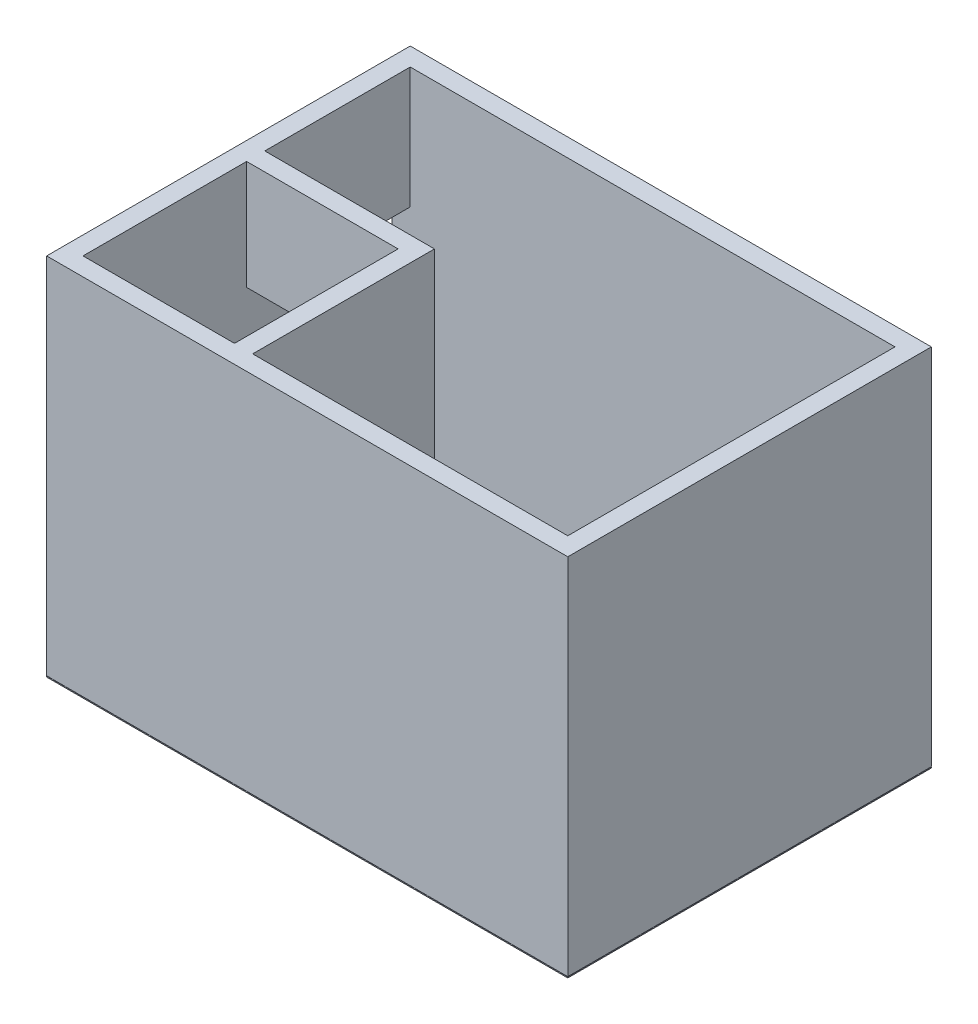
from build123d import *

# Parameters (mm, degrees)
EXTRUDE_THIN1_OUTLINE_W   = 4300
EXTRUDE_THIN1_OUTLINE_H   = 3000
EXTRUDE_THIN1_OUTLINE_W_2 = 1250
EXTRUDE_THIN1_OUTLINE_H_2 = 1350
EXTRUDE_THIN1_DEPTH       = 3000
SKETCH2_W                 = 4300
SKETCH2_H                 = 3000
BOSS_EXTRUDE1_DEPTH       = 10
SKETCH4_W                 = 750
SKETCH4_H                 = 2000
CUT_EXTRUDE2_DEPTH        = 150
SKETCH5_W                 = 1000
SKETCH5_H                 = 1000
SKETCH5_W_2               = 600
SKETCH5_H_2               = 600
CUT_EXTRUDE3_DEPTH        = 150
SKETCH3_W                 = 750
SKETCH3_H                 = 2000
CUT_EXTRUDE6_DEPTH        = 150
BOSS_EXTRUDE2_DEPTH       = 100
SKETCH9_OUTSIDE_W         = 5511.134
SKETCH9_OUTSIDE_H         = 4211.134
SKETCH9_OUTSIDE_W_2       = 295
SKETCH9_OUTSIDE_H_2       = 295
SKETCH9_OUTSIDE_W_3       = 265
SKETCH9_OUTSIDE_H_3       = 120
SKETCH9_OUTSIDE_W_4       = 170
SKETCH9_OUTSIDE_W_5       = 50
SKETCH9_OUTSIDE_H_4       = 250
SKETCH9_OUTSIDE_W_6       = 49.914712664
SKETCH9_OUTSIDE_W_7       = 150
CUT_EXTRUDE7_DEPTH        = 2
SKETCH11_W                = 750
SKETCH11_H                = 100
CUT_EXTRUDE9_DEPTH        = 182
SKETCH14_R                = 62.5
CUT_EXTRUDE11_DEPTH       = 10


# Read off the part's stored shape, not the designer's step: Extrude-Thin1
with BuildPart() as part:
    # Extrude-Thin1 outline → Extrude-Thin1 (new body)
    with BuildSketch(Plane(origin=(0, 0, 0), x_dir=(1, 0, 0), z_dir=(0, 1, 0))):
        with Locations((-2000, -1334.057701573)):
            Rectangle(EXTRUDE_THIN1_OUTLINE_W, EXTRUDE_THIN1_OUTLINE_H)
        with Locations((-3375, -2009.057701573)):
            Rectangle(EXTRUDE_THIN1_OUTLINE_W_2, EXTRUDE_THIN1_OUTLINE_H_2, mode=Mode.SUBTRACT)
        Polygon((-2600, -2684.057701573), (-2600, -1184.057701573), (-4000, -1184.057701573), (-4000, 15.942298427), (0, 15.942298427), (0, -2684.057701573), align=None, mode=Mode.SUBTRACT)
    extrude(amount=EXTRUDE_THIN1_DEPTH)

    # Sketch2 → Boss-Extrude1 (add)
    with BuildSketch(Plane.XZ):
        with Locations((-2000, 1334.057701573)):
            Rectangle(SKETCH2_W, SKETCH2_H)
    extrude(amount=BOSS_EXTRUDE1_DEPTH)

    # Sketch4 → Cut-Extrude2 (cut)
    with BuildSketch(Plane(origin=(0, 0, 1184.057701573), x_dir=(-1, 0, 0), z_dir=(0, 0, -1))):
        with Locations((3625, 1100)):
            Rectangle(SKETCH4_W, SKETCH4_H)
    extrude(amount=-CUT_EXTRUDE2_DEPTH, mode=Mode.SUBTRACT)

    # Sketch5 → Cut-Extrude3 (cut)
    with BuildSketch(Plane(origin=(-4000, 0, 0), x_dir=(0, 0, -1), z_dir=(1, 0, 0))):
        with Locations((-484.057701573, 1500)):
            Rectangle(SKETCH5_W, SKETCH5_H)
        with Locations((-2009.057701573, 1700)):
            Rectangle(SKETCH5_W_2, SKETCH5_H_2)
    extrude(amount=-CUT_EXTRUDE3_DEPTH, mode=Mode.SUBTRACT)

    # Sketch3 → Cut-Extrude6 (cut, symmetric)
    with BuildSketch(Plane.XY.offset(-15.942298427)):
        with Locations((-425, 1000)):
            Rectangle(SKETCH3_W, SKETCH3_H)
    extrude(amount=CUT_EXTRUDE6_DEPTH, both=True, mode=Mode.SUBTRACT)

    # Sketch6 → Boss-Extrude2 (add)
    with BuildSketch(Plane(origin=(0, 0, 0), x_dir=(1, 0, 0), z_dir=(0, 1, 0))):
        Polygon((-800, 15.942298427), (-4000, 15.942298427), (-4000, -1184.057701573), (-2600, -1184.057701573), (-2600, -2684.057701573), (0, -2684.057701573), (0, 15.942298427), (-50, 15.942298427), (-50, 165.942298427), (-800, 165.942298427), align=None)
        Polygon((-780, 145.942298427), (-70, 145.942298427), (-70, -4.057701573), (-20, -4.057701573), (-20, -2664.057701573), (-2580, -2664.057701573), (-2580, -1164.057701573), (-3980, -1164.057701573), (-3980, -4.057701573), (-780, -4.057701573), align=None, mode=Mode.SUBTRACT)
    extrude(amount=BOSS_EXTRUDE2_DEPTH)

    # Sketch9 outside → Cut-Extrude7 (cut)
    with BuildSketch(Plane(origin=(0, 0, 0), x_dir=(1, 0, 0), z_dir=(0, 1, 0))):
        with Locations((-2000, -1334.058)):
            Rectangle(SKETCH9_OUTSIDE_W, SKETCH9_OUTSIDE_H)
        with Locations((-172.5, -2511.557701573)):
            Rectangle(SKETCH9_OUTSIDE_W_2, SKETCH9_OUTSIDE_H_2, mode=Mode.SUBTRACT)
        with Locations((-172.5, -2211.557701573)):
            Rectangle(SKETCH9_OUTSIDE_W_2, SKETCH9_OUTSIDE_H_2, mode=Mode.SUBTRACT)
        with Locations((-172.5, -1911.557701573)):
            Rectangle(SKETCH9_OUTSIDE_W_2, SKETCH9_OUTSIDE_H_2, mode=Mode.SUBTRACT)
        with Locations((-172.5, -1611.557701573)):
            Rectangle(SKETCH9_OUTSIDE_W_2, SKETCH9_OUTSIDE_H_2, mode=Mode.SUBTRACT)
        with Locations((-172.5, -1311.557701573)):
            Rectangle(SKETCH9_OUTSIDE_W_2, SKETCH9_OUTSIDE_H_2, mode=Mode.SUBTRACT)
        with Locations((-172.5, -1011.557701573)):
            Rectangle(SKETCH9_OUTSIDE_W_2, SKETCH9_OUTSIDE_H_2, mode=Mode.SUBTRACT)
        with Locations((-172.5, -711.557701573)):
            Rectangle(SKETCH9_OUTSIDE_W_2, SKETCH9_OUTSIDE_H_2, mode=Mode.SUBTRACT)
        with Locations((-172.5, -411.557701573)):
            Rectangle(SKETCH9_OUTSIDE_W_2, SKETCH9_OUTSIDE_H_2, mode=Mode.SUBTRACT)
        Polygon((-25, -259.057701573), (-25, -9.057701573), (-55, -9.057701573), (-55, 35.942298427), (-320, 35.942298427), (-320, -259.057701573), align=None, mode=Mode.SUBTRACT)
        with Locations((-187.5, 100.942298427)):
            Rectangle(SKETCH9_OUTSIDE_W_3, SKETCH9_OUTSIDE_H_3, mode=Mode.SUBTRACT)
        with Locations((-472.5, -2511.557701573)):
            Rectangle(SKETCH9_OUTSIDE_W_2, SKETCH9_OUTSIDE_H_2, mode=Mode.SUBTRACT)
        with Locations((-472.5, -2211.557701573)):
            Rectangle(SKETCH9_OUTSIDE_W_2, SKETCH9_OUTSIDE_H_2, mode=Mode.SUBTRACT)
        with Locations((-472.5, -1911.557701573)):
            Rectangle(SKETCH9_OUTSIDE_W_2, SKETCH9_OUTSIDE_H_2, mode=Mode.SUBTRACT)
        with Locations((-472.5, -1611.557701573)):
            Rectangle(SKETCH9_OUTSIDE_W_2, SKETCH9_OUTSIDE_H_2, mode=Mode.SUBTRACT)
        with Locations((-472.5, -1311.557701573)):
            Rectangle(SKETCH9_OUTSIDE_W_2, SKETCH9_OUTSIDE_H_2, mode=Mode.SUBTRACT)
        with Locations((-472.5, -1011.557701573)):
            Rectangle(SKETCH9_OUTSIDE_W_2, SKETCH9_OUTSIDE_H_2, mode=Mode.SUBTRACT)
        with Locations((-472.5, -711.557701573)):
            Rectangle(SKETCH9_OUTSIDE_W_2, SKETCH9_OUTSIDE_H_2, mode=Mode.SUBTRACT)
        with Locations((-472.5, -411.557701573)):
            Rectangle(SKETCH9_OUTSIDE_W_2, SKETCH9_OUTSIDE_H_2, mode=Mode.SUBTRACT)
        with Locations((-772.5, -2511.557701573)):
            Rectangle(SKETCH9_OUTSIDE_W_2, SKETCH9_OUTSIDE_H_2, mode=Mode.SUBTRACT)
        with Locations((-772.5, -2211.557701573)):
            Rectangle(SKETCH9_OUTSIDE_W_2, SKETCH9_OUTSIDE_H_2, mode=Mode.SUBTRACT)
        with Locations((-772.5, -1911.557701573)):
            Rectangle(SKETCH9_OUTSIDE_W_2, SKETCH9_OUTSIDE_H_2, mode=Mode.SUBTRACT)
        with Locations((-772.5, -1611.557701573)):
            Rectangle(SKETCH9_OUTSIDE_W_2, SKETCH9_OUTSIDE_H_2, mode=Mode.SUBTRACT)
        with Locations((-772.5, -1311.557701573)):
            Rectangle(SKETCH9_OUTSIDE_W_2, SKETCH9_OUTSIDE_H_2, mode=Mode.SUBTRACT)
        with Locations((-772.5, -1011.557701573)):
            Rectangle(SKETCH9_OUTSIDE_W_2, SKETCH9_OUTSIDE_H_2, mode=Mode.SUBTRACT)
        with Locations((-772.5, -711.557701573)):
            Rectangle(SKETCH9_OUTSIDE_W_2, SKETCH9_OUTSIDE_H_2, mode=Mode.SUBTRACT)
        with Locations((-772.5, -411.557701573)):
            Rectangle(SKETCH9_OUTSIDE_W_2, SKETCH9_OUTSIDE_H_2, mode=Mode.SUBTRACT)
        with Locations((-1072.5, -2511.557701573)):
            Rectangle(SKETCH9_OUTSIDE_W_2, SKETCH9_OUTSIDE_H_2, mode=Mode.SUBTRACT)
        with Locations((-1072.5, -2211.557701573)):
            Rectangle(SKETCH9_OUTSIDE_W_2, SKETCH9_OUTSIDE_H_2, mode=Mode.SUBTRACT)
        with Locations((-1072.5, -1911.557701573)):
            Rectangle(SKETCH9_OUTSIDE_W_2, SKETCH9_OUTSIDE_H_2, mode=Mode.SUBTRACT)
        with Locations((-1072.5, -1611.557701573)):
            Rectangle(SKETCH9_OUTSIDE_W_2, SKETCH9_OUTSIDE_H_2, mode=Mode.SUBTRACT)
        with Locations((-1072.5, -1311.557701573)):
            Rectangle(SKETCH9_OUTSIDE_W_2, SKETCH9_OUTSIDE_H_2, mode=Mode.SUBTRACT)
        with Locations((-1072.5, -1011.557701573)):
            Rectangle(SKETCH9_OUTSIDE_W_2, SKETCH9_OUTSIDE_H_2, mode=Mode.SUBTRACT)
        with Locations((-1072.5, -711.557701573)):
            Rectangle(SKETCH9_OUTSIDE_W_2, SKETCH9_OUTSIDE_H_2, mode=Mode.SUBTRACT)
        with Locations((-1072.5, -411.557701573)):
            Rectangle(SKETCH9_OUTSIDE_W_2, SKETCH9_OUTSIDE_H_2, mode=Mode.SUBTRACT)
        with Locations((-1372.5, -2511.557701573)):
            Rectangle(SKETCH9_OUTSIDE_W_2, SKETCH9_OUTSIDE_H_2, mode=Mode.SUBTRACT)
        with Locations((-1372.5, -2211.557701573)):
            Rectangle(SKETCH9_OUTSIDE_W_2, SKETCH9_OUTSIDE_H_2, mode=Mode.SUBTRACT)
        with Locations((-1372.5, -1911.557701573)):
            Rectangle(SKETCH9_OUTSIDE_W_2, SKETCH9_OUTSIDE_H_2, mode=Mode.SUBTRACT)
        with Locations((-1372.5, -1611.557701573)):
            Rectangle(SKETCH9_OUTSIDE_W_2, SKETCH9_OUTSIDE_H_2, mode=Mode.SUBTRACT)
        with Locations((-1372.5, -1311.557701573)):
            Rectangle(SKETCH9_OUTSIDE_W_2, SKETCH9_OUTSIDE_H_2, mode=Mode.SUBTRACT)
        with Locations((-1372.5, -1011.557701573)):
            Rectangle(SKETCH9_OUTSIDE_W_2, SKETCH9_OUTSIDE_H_2, mode=Mode.SUBTRACT)
        with Locations((-1372.5, -711.557701573)):
            Rectangle(SKETCH9_OUTSIDE_W_2, SKETCH9_OUTSIDE_H_2, mode=Mode.SUBTRACT)
        with Locations((-1372.5, -411.557701573)):
            Rectangle(SKETCH9_OUTSIDE_W_2, SKETCH9_OUTSIDE_H_2, mode=Mode.SUBTRACT)
        with Locations((-1672.5, -2511.557701573)):
            Rectangle(SKETCH9_OUTSIDE_W_2, SKETCH9_OUTSIDE_H_2, mode=Mode.SUBTRACT)
        with Locations((-1672.5, -2211.557701573)):
            Rectangle(SKETCH9_OUTSIDE_W_2, SKETCH9_OUTSIDE_H_2, mode=Mode.SUBTRACT)
        with Locations((-1672.5, -1911.557701573)):
            Rectangle(SKETCH9_OUTSIDE_W_2, SKETCH9_OUTSIDE_H_2, mode=Mode.SUBTRACT)
        with Locations((-1672.5, -1611.557701573)):
            Rectangle(SKETCH9_OUTSIDE_W_2, SKETCH9_OUTSIDE_H_2, mode=Mode.SUBTRACT)
        with Locations((-1672.5, -1311.557701573)):
            Rectangle(SKETCH9_OUTSIDE_W_2, SKETCH9_OUTSIDE_H_2, mode=Mode.SUBTRACT)
        with Locations((-1672.5, -1011.557701573)):
            Rectangle(SKETCH9_OUTSIDE_W_2, SKETCH9_OUTSIDE_H_2, mode=Mode.SUBTRACT)
        with Locations((-1672.5, -711.557701573)):
            Rectangle(SKETCH9_OUTSIDE_W_2, SKETCH9_OUTSIDE_H_2, mode=Mode.SUBTRACT)
        with Locations((-1672.5, -411.557701573)):
            Rectangle(SKETCH9_OUTSIDE_W_2, SKETCH9_OUTSIDE_H_2, mode=Mode.SUBTRACT)
        with Locations((-1972.5, -2511.557701573)):
            Rectangle(SKETCH9_OUTSIDE_W_2, SKETCH9_OUTSIDE_H_2, mode=Mode.SUBTRACT)
        with Locations((-1972.5, -2211.557701573)):
            Rectangle(SKETCH9_OUTSIDE_W_2, SKETCH9_OUTSIDE_H_2, mode=Mode.SUBTRACT)
        with Locations((-1972.5, -1911.557701573)):
            Rectangle(SKETCH9_OUTSIDE_W_2, SKETCH9_OUTSIDE_H_2, mode=Mode.SUBTRACT)
        with Locations((-1972.5, -1611.557701573)):
            Rectangle(SKETCH9_OUTSIDE_W_2, SKETCH9_OUTSIDE_H_2, mode=Mode.SUBTRACT)
        with Locations((-1972.5, -1311.557701573)):
            Rectangle(SKETCH9_OUTSIDE_W_2, SKETCH9_OUTSIDE_H_2, mode=Mode.SUBTRACT)
        with Locations((-1972.5, -1011.557701573)):
            Rectangle(SKETCH9_OUTSIDE_W_2, SKETCH9_OUTSIDE_H_2, mode=Mode.SUBTRACT)
        with Locations((-1972.5, -711.557701573)):
            Rectangle(SKETCH9_OUTSIDE_W_2, SKETCH9_OUTSIDE_H_2, mode=Mode.SUBTRACT)
        with Locations((-1972.5, -411.557701573)):
            Rectangle(SKETCH9_OUTSIDE_W_2, SKETCH9_OUTSIDE_H_2, mode=Mode.SUBTRACT)
        with Locations((-2272.5, -2511.557701573)):
            Rectangle(SKETCH9_OUTSIDE_W_2, SKETCH9_OUTSIDE_H_2, mode=Mode.SUBTRACT)
        with Locations((-2272.5, -2211.557701573)):
            Rectangle(SKETCH9_OUTSIDE_W_2, SKETCH9_OUTSIDE_H_2, mode=Mode.SUBTRACT)
        with Locations((-2272.5, -1911.557701573)):
            Rectangle(SKETCH9_OUTSIDE_W_2, SKETCH9_OUTSIDE_H_2, mode=Mode.SUBTRACT)
        with Locations((-2272.5, -1611.557701573)):
            Rectangle(SKETCH9_OUTSIDE_W_2, SKETCH9_OUTSIDE_H_2, mode=Mode.SUBTRACT)
        with Locations((-2272.5, -1311.557701573)):
            Rectangle(SKETCH9_OUTSIDE_W_2, SKETCH9_OUTSIDE_H_2, mode=Mode.SUBTRACT)
        with Locations((-2272.5, -1011.557701573)):
            Rectangle(SKETCH9_OUTSIDE_W_2, SKETCH9_OUTSIDE_H_2, mode=Mode.SUBTRACT)
        with Locations((-2272.5, -711.557701573)):
            Rectangle(SKETCH9_OUTSIDE_W_2, SKETCH9_OUTSIDE_H_2, mode=Mode.SUBTRACT)
        with Locations((-2272.5, -411.557701573)):
            Rectangle(SKETCH9_OUTSIDE_W_2, SKETCH9_OUTSIDE_H_2, mode=Mode.SUBTRACT)
        with Locations((-472.5, -111.557701573)):
            Rectangle(SKETCH9_OUTSIDE_W_2, SKETCH9_OUTSIDE_H_2, mode=Mode.SUBTRACT)
        Polygon((-625, -259.057701573), (-625, 35.942298427), (-795, 35.942298427), (-795, -9.057701573), (-920, -9.057701573), (-920, -259.057701573), align=None, mode=Mode.SUBTRACT)
        with Locations((-472.5, 100.942298427)):
            Rectangle(SKETCH9_OUTSIDE_W_2, SKETCH9_OUTSIDE_H_3, mode=Mode.SUBTRACT)
        with Locations((-710, 100.942298427)):
            Rectangle(SKETCH9_OUTSIDE_W_4, SKETCH9_OUTSIDE_H_3, mode=Mode.SUBTRACT)
        with Locations((-3950, -411.557701573)):
            Rectangle(SKETCH9_OUTSIDE_W_5, SKETCH9_OUTSIDE_H_2, mode=Mode.SUBTRACT)
        with Locations((-1072.5, -134.057701573)):
            Rectangle(SKETCH9_OUTSIDE_W_2, SKETCH9_OUTSIDE_H_4, mode=Mode.SUBTRACT)
        with Locations((-1372.509476371, -134.057701573)):
            Rectangle(SKETCH9_OUTSIDE_W_2, SKETCH9_OUTSIDE_H_4, mode=Mode.SUBTRACT)
        with Locations((-1672.518952741, -134.057701573)):
            Rectangle(SKETCH9_OUTSIDE_W_2, SKETCH9_OUTSIDE_H_4, mode=Mode.SUBTRACT)
        with Locations((-1972.528429112, -134.057701573)):
            Rectangle(SKETCH9_OUTSIDE_W_2, SKETCH9_OUTSIDE_H_4, mode=Mode.SUBTRACT)
        with Locations((-2272.537905483, -134.057701573)):
            Rectangle(SKETCH9_OUTSIDE_W_2, SKETCH9_OUTSIDE_H_4, mode=Mode.SUBTRACT)
        with Locations((-2572.547381854, -134.057701573)):
            Rectangle(SKETCH9_OUTSIDE_W_2, SKETCH9_OUTSIDE_H_4, mode=Mode.SUBTRACT)
        with Locations((-2872.556858224, -134.057701573)):
            Rectangle(SKETCH9_OUTSIDE_W_2, SKETCH9_OUTSIDE_H_4, mode=Mode.SUBTRACT)
        with Locations((-3172.566334595, -134.057701573)):
            Rectangle(SKETCH9_OUTSIDE_W_2, SKETCH9_OUTSIDE_H_4, mode=Mode.SUBTRACT)
        with Locations((-3472.575810966, -134.057701573)):
            Rectangle(SKETCH9_OUTSIDE_W_2, SKETCH9_OUTSIDE_H_4, mode=Mode.SUBTRACT)
        with Locations((-3772.585287336, -134.057701573)):
            Rectangle(SKETCH9_OUTSIDE_W_2, SKETCH9_OUTSIDE_H_4, mode=Mode.SUBTRACT)
        with Locations((-2572.5, -411.557701573)):
            Rectangle(SKETCH9_OUTSIDE_W_2, SKETCH9_OUTSIDE_H_2, mode=Mode.SUBTRACT)
        with Locations((-2572.5, -711.557701573)):
            Rectangle(SKETCH9_OUTSIDE_W_2, SKETCH9_OUTSIDE_H_2, mode=Mode.SUBTRACT)
        with Locations((-2572.5, -1011.557701573)):
            Rectangle(SKETCH9_OUTSIDE_W_2, SKETCH9_OUTSIDE_H_2, mode=Mode.SUBTRACT)
        with Locations((-2872.5, -411.557701573)):
            Rectangle(SKETCH9_OUTSIDE_W_2, SKETCH9_OUTSIDE_H_2, mode=Mode.SUBTRACT)
        with Locations((-2872.5, -711.557701573)):
            Rectangle(SKETCH9_OUTSIDE_W_2, SKETCH9_OUTSIDE_H_2, mode=Mode.SUBTRACT)
        with Locations((-2872.5, -1011.557701573)):
            Rectangle(SKETCH9_OUTSIDE_W_2, SKETCH9_OUTSIDE_H_2, mode=Mode.SUBTRACT)
        with Locations((-3172.5, -411.557701573)):
            Rectangle(SKETCH9_OUTSIDE_W_2, SKETCH9_OUTSIDE_H_2, mode=Mode.SUBTRACT)
        with Locations((-3172.5, -711.557701573)):
            Rectangle(SKETCH9_OUTSIDE_W_2, SKETCH9_OUTSIDE_H_2, mode=Mode.SUBTRACT)
        with Locations((-3172.5, -1011.557701573)):
            Rectangle(SKETCH9_OUTSIDE_W_2, SKETCH9_OUTSIDE_H_2, mode=Mode.SUBTRACT)
        with Locations((-3472.5, -411.557701573)):
            Rectangle(SKETCH9_OUTSIDE_W_2, SKETCH9_OUTSIDE_H_2, mode=Mode.SUBTRACT)
        with Locations((-3472.5, -711.557701573)):
            Rectangle(SKETCH9_OUTSIDE_W_2, SKETCH9_OUTSIDE_H_2, mode=Mode.SUBTRACT)
        with Locations((-3472.5, -1011.557701573)):
            Rectangle(SKETCH9_OUTSIDE_W_2, SKETCH9_OUTSIDE_H_2, mode=Mode.SUBTRACT)
        with Locations((-3772.5, -411.557701573)):
            Rectangle(SKETCH9_OUTSIDE_W_2, SKETCH9_OUTSIDE_H_2, mode=Mode.SUBTRACT)
        with Locations((-3772.5, -711.557701573)):
            Rectangle(SKETCH9_OUTSIDE_W_2, SKETCH9_OUTSIDE_H_2, mode=Mode.SUBTRACT)
        with Locations((-3772.5, -1011.557701573)):
            Rectangle(SKETCH9_OUTSIDE_W_2, SKETCH9_OUTSIDE_H_2, mode=Mode.SUBTRACT)
        with Locations((-3950.042643668, -134.057701573)):
            Rectangle(SKETCH9_OUTSIDE_W_6, SKETCH9_OUTSIDE_H_4, mode=Mode.SUBTRACT)
        with Locations((-3950, -711.557701573)):
            Rectangle(SKETCH9_OUTSIDE_W_5, SKETCH9_OUTSIDE_H_2, mode=Mode.SUBTRACT)
        with Locations((-3950, -1011.557701573)):
            Rectangle(SKETCH9_OUTSIDE_W_5, SKETCH9_OUTSIDE_H_2, mode=Mode.SUBTRACT)
        with Locations((-2500, -2511.557701573)):
            Rectangle(SKETCH9_OUTSIDE_W_7, SKETCH9_OUTSIDE_H_2, mode=Mode.SUBTRACT)
        with Locations((-2500, -2211.557701573)):
            Rectangle(SKETCH9_OUTSIDE_W_7, SKETCH9_OUTSIDE_H_2, mode=Mode.SUBTRACT)
        with Locations((-2500, -1911.557701573)):
            Rectangle(SKETCH9_OUTSIDE_W_7, SKETCH9_OUTSIDE_H_2, mode=Mode.SUBTRACT)
        with Locations((-2500, -1611.557701573)):
            Rectangle(SKETCH9_OUTSIDE_W_7, SKETCH9_OUTSIDE_H_2, mode=Mode.SUBTRACT)
        with Locations((-2500, -1311.557701573)):
            Rectangle(SKETCH9_OUTSIDE_W_7, SKETCH9_OUTSIDE_H_2, mode=Mode.SUBTRACT)
    extrude(amount=-CUT_EXTRUDE7_DEPTH, mode=Mode.SUBTRACT)

    # Sketch11 → Cut-Extrude9 (cut)
    with BuildSketch(Plane(origin=(0, 0, -165.942298427), x_dir=(-1, 0, 0), z_dir=(0, 0, -1))):
        with Locations((425, 50)):
            Rectangle(SKETCH11_W, SKETCH11_H)
    extrude(amount=-CUT_EXTRUDE9_DEPTH, mode=Mode.SUBTRACT)


with BuildPart() as cut_extrude9_piece_1:
    # of the separate pieces the step leaves, piece 1, a body of its own (cut_extrude9_pieces)
    add(part.part.solids().sort_by_distance((-4150, 3000, 2834.057701573))[0])


with BuildPart() as cut_extrude9_piece_2:
    # of the separate pieces the step leaves, piece 2, a body of its own (cut_extrude9_pieces)
    add(part.part.solids().sort_by_distance((-55, 0, 9.057701573))[0])

    # Sketch14 → Cut-Extrude11 (cut)
    with BuildSketch(Plane(origin=(0, -2, 0), x_dir=(1, 0, 0), z_dir=(0, 1, 0))):
        with Locations(Location((-3050, -2284.057701573, 0), (0, 0, 270))):
            Circle(SKETCH14_R)
    extrude(amount=-CUT_EXTRUDE11_DEPTH, mode=Mode.SUBTRACT)


solid = Compound([cut_extrude9_piece_1.part, cut_extrude9_piece_2.part])
